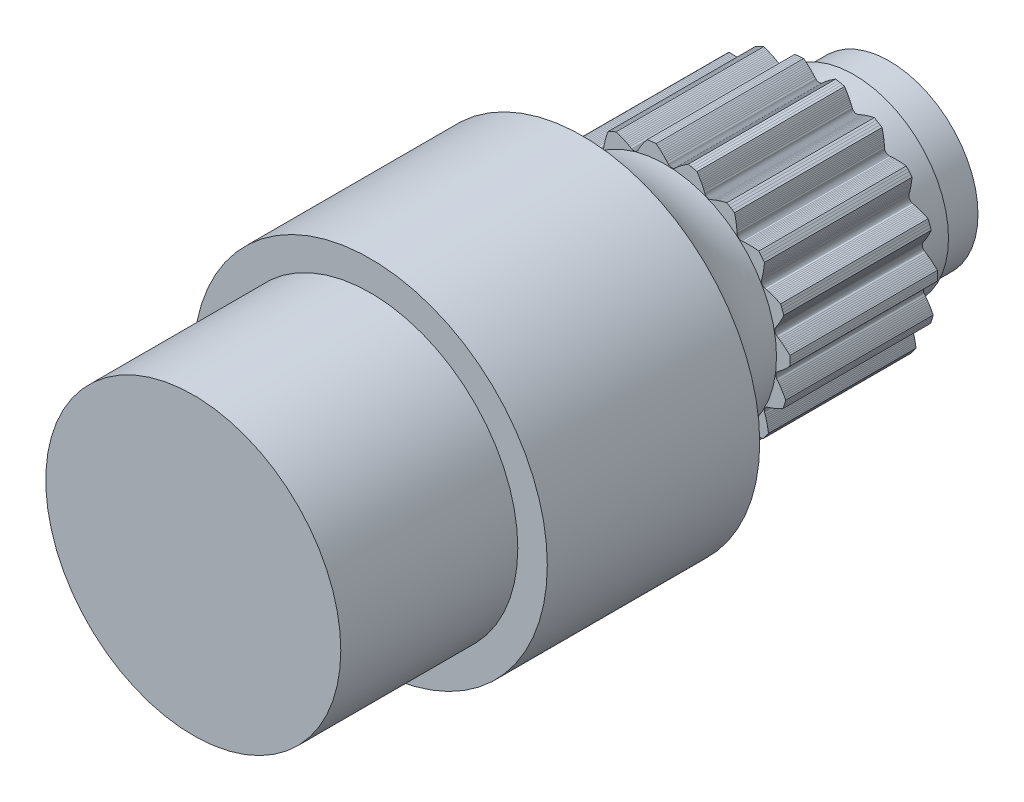
from build123d import *

# Parameters (mm, degrees)
BOSS_EXTRUDE1_DEPTH      = 6
BOSS_EXTRUDE1_DEPTH_BACK = 6.5


with BuildPart() as part:
    # 19T Shaft → Boss-Extrude1 (new, two sides: drawn at the far end of the back side and taken through both)
    with BuildSketch(Plane.XY.offset(-BOSS_EXTRUDE1_DEPTH_BACK)):
        Polygon((6.023106356, -8.692720522), (5.86435407, -8.800599502), (5.703670084, -8.90557959), (5.574457194, -8.88263519), (5.447639445, -8.857900166), (5.323239894, -8.831448754), (5.198405862, -8.802667164), (5.076149615, -8.772244747), (4.956489957, -8.740261879), (4.836752896, -8.706003916), (4.719768004, -8.670282776), (4.602985258, -8.632326454), (4.489107653, -8.593022605), (4.327362162, -8.533132654), (4.290916776, -8.521301114), (4.254021844, -8.513594141), (4.215833329, -8.509876971), (4.177758776, -8.510371404), (4.140158745, -8.515007457), (4.103409314, -8.523695892), (4.067890602, -8.536320589), (4.053138471, -8.54290106), (4.042867825, -8.547766359), (4.032591339, -8.552619311), (4.022309028, -8.557459908), (4.012020905, -8.562288143), (3.997558248, -8.569482551), (3.965220019, -8.588852651), (3.935135554, -8.611676643), (3.907636288, -8.637735147), (3.883030341, -8.666794799), (3.861601106, -8.698621956), (3.844073002, -8.731989591), (3.830012988, -8.767634612), (3.773308927, -8.930524327), (3.731178233, -9.04338666), (3.686159572, -9.157632939), (3.63928787, -9.270613062), (3.589536303, -9.384785534), (3.538078764, -9.497450788), (3.483765299, -9.611126472), (3.426545863, -9.725746938), (3.367805145, -9.838549658), (3.306201696, -9.952125968), (3.241692914, -10.066410845), (3.058468233, -10.123584954), (2.874236101, -10.177424384), (2.689057204, -10.2279114), (2.50299254, -10.275029372), (2.388230796, -10.211372806), (2.276315831, -10.146800338), (2.167245351, -10.081389669), (2.058520538, -10.013634001), (1.952766614, -9.945163416), (1.849975267, -9.87606004), (1.747849432, -9.804779708), (1.64880174, -9.733009106), (1.550671003, -9.659190066), (1.455725539, -9.585039811), (1.3221901, -9.475876187), (1.291561121, -9.452851915), (1.259167708, -9.433582762), (1.224255315, -9.417667208), (1.188083204, -9.405772064), (1.151015123, -9.397948213), (1.113435747, -9.394233364), (1.075742305, -9.394641113), (1.05965281, -9.396075027), (1.048358895, -9.397341838), (1.037063467, -9.398595073), (1.02576654, -9.399834732), (1.014468131, -9.401060812), (0.99845308, -9.403169391), (0.961577565, -9.410989759), (0.925712221, -9.422808675), (0.891241758, -9.43852626), (0.858533375, -9.458021842), (0.827930974, -9.481166455), (0.800518138, -9.507034773), (0.775646016, -9.536183169), (0.669124132, -9.671835292), (0.592629856, -9.764902619), (0.512954724, -9.858341183), (0.431938074, -9.949980515), (0.347810443, -10.0418125), (0.262558668, -10.131665005), (0.174277622, -10.221545872), (0.082941288, -10.311376766), (-0.009243679, -10.398994443), (-0.104387451, -10.486414267), (-0.202509208, -10.573560908), (-0.394370673, -10.568144209), (-0.586102234, -10.559246395), (-0.777640735, -10.546870395), (-0.968923083, -10.531020288), (-1.056797466, -10.433549734), (-1.141681923, -10.33613725), (-1.223603855, -10.238855584), (-1.304437427, -10.139468216), (-1.382228949, -10.040369314), (-1.457012949, -9.941633853), (-1.530460638, -9.841055481), (-1.600837777, -9.741012876), (-1.669682517, -9.639330557), (-1.735407025, -9.538369225), (-1.826261774, -9.391761502), (-1.847755223, -9.360039535), (-1.872136787, -9.331296313), (-1.899989758, -9.304907073), (-1.930339618, -9.281911376), (-1.962858848, -9.262475456), (-1.99719586, -9.246759884), (-2.032979363, -9.234906499), (-2.048662676, -9.23103847), (-2.059755988, -9.228569513), (-2.070846324, -9.226087225), (-2.081933669, -9.22359161), (-2.093018006, -9.22108267), (-2.108849972, -9.217876922), (-2.14626674, -9.2133001), (-2.184026396, -9.212833176), (-2.221732645, -9.216506598), (-2.258999003, -9.224325462), (-2.295458325, -9.236279452), (-2.329785287, -9.25184522), (-2.362774238, -9.271338311), (-2.507570644, -9.365052828), (-2.610139161, -9.42823986), (-2.715836727, -9.490745192), (-2.822218914, -9.551113189), (-2.931606074, -9.610653267), (-3.041413734, -9.667956109), (-3.154095739, -9.724302174), (-3.269651262, -9.779608923), (-3.385290807, -9.832546823), (-3.503664597, -9.884336868), (-3.624766315, -9.93490158), (-3.804473398, -9.867481057), (-3.982927298, -9.796810215), (-4.160069234, -9.722912332), (-4.335840855, -9.645811751), (-4.387305324, -9.525089654), (-4.435960726, -9.405393309), (-4.481856596, -9.286782624), (-4.526039357, -9.16653372), (-4.567438559, -9.047545404), (-4.606111203, -8.929877377), (-4.64292155, -8.810900194), (-4.677001681, -8.693426753), (-4.709100028, -8.574900013), (-4.73848131, -8.458068331), (-4.776809849, -8.28990373), (-4.786838617, -8.252921635), (-4.800566212, -8.21781912), (-4.81834146, -8.183815876), (-4.83958019, -8.152211566), (-4.864026605, -8.123269761), (-4.891400306, -8.097256493), (-4.921396172, -8.074426472), (-4.934973773, -8.06567566), (-4.944664349, -8.059738486), (-4.954347783, -8.053789669), (-4.96402406, -8.047829218), (-4.973693166, -8.041857141), (-4.987626407, -8.033684458), (-5.02152974, -8.017206417), (-5.057091864, -8.004504252), (-5.093947842, -7.995735439), (-5.131733787, -7.991030288), (-5.170099097, -7.990498255), (-5.207620326, -7.994074681), (-5.245151241, -8.001800087), (-5.412531233, -8.043421577), (-5.5300591, -8.069881018), (-5.650325129, -8.094679696), (-5.770544691, -8.117234549), (-5.893337586, -8.138030628), (-6.015801766, -8.156574154), (-6.140673887, -8.173279448), (-6.267926365, -8.188068707), (-6.394489147, -8.200590186), (-6.52326532, -8.211138197), (-6.654223748, -8.219641511), (-6.802302397, -8.097523223), (-6.948140388, -7.972737635), (-7.091689682, -7.845325851), (-7.232902994, -7.71532984), (-7.242380575, -7.584438313), (-7.249534353, -7.455429064), (-7.254430632, -7.328342668), (-7.257174694, -7.200263062), (-7.25769533, -7.074279562), (-7.256065838, -6.950430127), (-7.25224987, -6.825947156), (-7.246339882, -6.703772949), (-7.238213482, -6.581245998), (-7.22806762, -6.461204493), (-7.209716456, -6.289706257), (-7.207193771, -6.251471619), (-7.208779799, -6.213813712), (-7.2145511, -6.175881244), (-7.224377154, -6.139093138), (-7.238101607, -6.103781743), (-7.25554563, -6.070289718), (-7.276503343, -6.03895705), (-7.286503887, -6.02627174), (-7.293741604, -6.017509734), (-7.300968785, -6.008739034), (-7.308185419, -5.999959655), (-7.315391496, -5.991171609), (-7.32591613, -5.978917628), (-7.352632076, -5.952324018), (-7.382142959, -5.928763089), (-7.41415475, -5.908502277), (-7.448365589, -5.891782988), (-7.484479409, -5.878822587), (-7.521128898, -5.870022109), (-7.55913472, -5.865142663), (-7.730960078, -5.850160792), (-7.850711327, -5.837025351), (-7.972513129, -5.821430052), (-8.093542412, -5.803727593), (-8.216434525, -5.783526095), (-8.338284331, -5.761300828), (-8.461814736, -5.736555071), (-8.586974388, -5.709224196), (-8.710745368, -5.679972359), (-8.835969026, -5.648135294), (-8.962592786, -5.613655743), (-9.062996383, -5.450073102), (-9.160414655, -5.284695223), (-9.254815513, -5.117576581), (-9.346167863, -4.948772225), (-9.312631514, -4.821895397), (-9.277508445, -4.697553396), (-9.240874545, -4.575763073), (-9.201882546, -4.453732178), (-9.161468197, -4.334405761), (-9.119713149, -4.217795925), (-9.075684387, -4.101296827), (-9.030424718, -3.987661327), (-8.982954192, -3.874411862), (-8.934380648, -3.764168892), (-8.861338415, -3.607921517), (-8.84653765, -3.572577651), (-8.83581024, -3.536445171), (-8.828952184, -3.49869405), (-8.826300756, -3.460708711), (-8.827815989, -3.422854262), (-8.833440005, -3.385512863), (-8.843088469, -3.349072926), (-8.848428244, -3.333827771), (-8.852428782, -3.323190431), (-8.856416533, -3.31254829), (-8.86039149, -3.301901365), (-8.864353648, -3.291249669), (-8.870329167, -3.2762423), (-8.886962638, -3.242414952), (-8.90722432, -3.210548451), (-8.930922949, -3.180991214), (-8.957851405, -3.154069581), (-8.987800244, -3.130085273), (-9.019606452, -3.109861559), (-9.05396866, -3.092906025), (-9.21161944, -3.02294431), (-9.320617166, -2.971637417), (-9.430755625, -2.917338134), (-9.539479229, -2.861296698), (-9.649153292, -2.80228677), (-9.757184407, -2.741701162), (-9.86598666, -2.678185941), (-9.975490496, -2.611696655), (-10.083057167, -2.543841392), (-10.191158384, -2.473069292), (-10.299725828, -2.39934327), (-10.341574084, -2.212022994), (-10.380015856, -2.023974083), (-10.415038481, -1.835258482), (-10.446630423, -1.645938351), (-10.373714327, -1.536825295), (-10.300120542, -1.430624928), (-10.225926314, -1.327328549), (-10.149423643, -1.224570305), (-10.07245383, -1.124831841), (-9.995098034, -1.028098089), (-9.915627676, -0.93220735), (-9.835922914, -0.839424724), (-9.754252432, -0.747725082), (-9.672514902, -0.659227184), (-9.552696859, -0.535162498), (-9.527221905, -0.506539461), (-9.505343539, -0.475847922), (-9.486599303, -0.442369069), (-9.471757717, -0.407302797), (-9.460899531, -0.371007411), (-9.454094089, -0.333863157), (-9.451387746, -0.296264785), (-9.451488102, -0.280111832), (-9.451817942, -0.26875188), (-9.452134128, -0.25739154), (-9.45243666, -0.246030827), (-9.452725538, -0.23466976), (-9.453504402, -0.218535283), (-9.458252904, -0.181139915), (-9.467069715, -0.144421071), (-9.479887068, -0.108770395), (-9.496615027, -0.074563795), (-9.517153462, -0.04215465), (-9.540669693, -0.012699254), (-9.567664609, 0.014494973), (-9.694056904, 0.131855094), (-9.780489511, 0.215773542), (-9.867029415, 0.302892639), (-9.951665451, 0.391200092), (-10.036236578, 0.482623809), (-10.118742155, 0.575004368), (-10.201025843, 0.670406192), (-10.283007423, 0.768848743), (-10.362713267, 0.867954262), (-10.441977599, 0.969992141), (-10.520723759, 1.074975276), (-10.499481766, 1.265734129), (-10.474781276, 1.456076054), (-10.446630423, 1.645938351), (-10.415038481, 1.835258482), (-10.310644228, 1.914783675), (-10.206554755, 1.991333949), (-10.102840296, 2.06494262), (-9.997117203, 2.137292761), (-9.8919328, 2.206635063), (-9.787358957, 2.273010127), (-9.68105885, 2.337901259), (-9.575546242, 2.399776572), (-9.468526067, 2.459989312), (-9.362482082, 2.517152017), (-9.208872373, 2.595589682), (-9.175483838, 2.61439014), (-9.144825375, 2.636314833), (-9.116226187, 2.661893466), (-9.09080276, 2.690240695), (-9.068747808, 2.72104385), (-9.050250384, 2.753965803), (-9.035482506, 2.788648242), (-9.03033257, 2.803958569), (-9.026955968, 2.814810107), (-9.023566326, 2.825657578), (-9.020163649, 2.836500968), (-9.016747941, 2.84734026), (-9.012245748, 2.862853423), (-9.004594707, 2.899764443), (-9.00101121, 2.937356572), (-9.001558328, 2.975237384), (-9.006273055, 3.013022135), (-9.015175429, 3.050344082), (-9.027853334, 3.085839212), (-9.04455564, 3.120325216), (-9.125992882, 3.272365952), (-9.180494057, 3.379802089), (-9.234057466, 3.490300294), (-9.285434305, 3.601304281), (-9.335737903, 3.71523461), (-9.383777181, 3.829399252), (-9.430625591, 3.946349412), (-9.476200939, 4.06607745), (-9.519408591, 4.185693603), (-9.561246517, 4.307939875), (-9.601638025, 4.43280357), (-9.519607684, 4.606329319), (-9.434441612, 4.778337757), (-9.346167863, 4.948772225), (-9.254815513, 5.117576581), (-9.130255842, 5.158896122), (-9.006950389, 5.197500894), (-8.884954769, 5.233445214), (-8.761467993, 5.267546993), (-8.639467362, 5.298978818), (-8.51900767, 5.327802427), (-8.39739708, 5.35466199), (-8.277510556, 5.37892484), (-8.156737984, 5.401125694), (-8.037879054, 5.420758741), (-7.867123675, 5.445069445), (-7.829439724, 5.452010003), (-7.793323485, 5.462791969), (-7.757968512, 5.47769854), (-7.724718266, 5.496254865), (-7.693856543, 5.518227788), (-7.665671621, 5.543359835), (-7.640442538, 5.571367962), (-7.630600384, 5.584176552), (-7.623883247, 5.593343743), (-7.617155097, 5.602502853), (-7.610415943, 5.61165387), (-7.603665796, 5.620796781), (-7.594370428, 5.634007538), (-7.575148953, 5.666434328), (-7.559553475, 5.700826053), (-7.54777107, 5.736832027), (-7.53996165, 5.774100366), (-7.536263253, 5.812290703), (-7.536728985, 5.849979117), (-7.541328727, 5.888019804), (-7.568985928, 6.058265184), (-7.585649622, 6.177576637), (-7.60043211, 6.299479755), (-7.612982274, 6.421151272), (-7.623567167, 6.545242092), (-7.631934346, 6.668819308), (-7.638270724, 6.794644439), (-7.642501044, 6.922683573), (-7.644528285, 7.049848095), (-7.644406017, 7.179055479), (-7.642065826, 7.310268816), (-7.508136396, 7.447757253), (-7.371733809, 7.582792421), (-7.232902994, 7.71532984), (-7.091689682, 7.845325851), (-6.960462564, 7.843962125), (-6.831303192, 7.84043797), (-6.704246529, 7.834822815), (-6.576377777, 7.826980774), (-6.450781581, 7.817095997), (-6.327489717, 7.805244665), (-6.203747038, 7.791162008), (-6.082478161, 7.775183139), (-5.961040775, 7.7569663), (-5.842247111, 7.736942142), (-5.672850056, 7.704491445), (-5.63495433, 7.698819985), (-5.59729407, 7.697290831), (-5.559014571, 7.699909982), (-5.521540686, 7.706664537), (-5.48521654, 7.717426122), (-5.450398392, 7.732044815), (-5.417442066, 7.750343515), (-5.403974245, 7.759262358), (-5.394644479, 7.765751794), (-5.385306921, 7.772230012), (-5.375961582, 7.778697002), (-5.366608478, 7.785152756), (-5.353527234, 7.794629517), (-5.32481827, 7.819058131), (-5.298900823, 7.846522574), (-5.2760657, 7.876751904), (-5.256578407, 7.909465227), (-5.240680017, 7.944385439), (-5.228883106, 7.980183013), (-5.22088183, 8.017656085), (-5.191761904, 8.187657379), (-5.168782347, 8.305914901), (-5.143182001, 8.426012838), (-5.115545485, 8.545166888), (-5.085264636, 8.665971035), (-5.053053003, 8.785569314), (-5.018190705, 8.906634312), (-4.980617576, 9.029109514), (-4.941244722, 9.150042156), (-4.89917551, 9.272209027), (-4.854357216, 9.395553005), (-4.68304203, 9.482105125), (-4.510184263, 9.565533867), (-4.335840855, 9.645811751), (-4.160069234, 9.722912332), (-4.036395164, 9.679013121), (-3.915378295, 9.633741935), (-3.797029151, 9.587175793), (-3.678634987, 9.53823974), (-3.563053521, 9.488109529), (-3.450290071, 9.436867532), (-3.337824743, 9.383368731), (-3.228314879, 9.328879701), (-3.119372303, 9.272219245), (-3.013517041, 9.214707812), (-2.863835109, 9.129012249), (-2.829834198, 9.111343363), (-2.794710991, 9.097668796), (-2.757655144, 9.0877167), (-2.720018497, 9.081937525), (-2.682168213, 9.080321586), (-2.644489926, 9.082842765), (-2.607377687, 9.089449089), (-2.591743646, 9.09351169), (-2.580812276, 9.096620141), (-2.569877178, 9.09971545), (-2.558938368, 9.102797615), (-2.547995861, 9.10586663), (-2.532546295, 9.110582441), (-2.497460903, 9.12436566), (-2.464030046, 9.141926622), (-2.432616745, 9.163103491), (-2.403563329, 9.187716803), (-2.377187783, 9.215582742), (-2.354406608, 9.245610255), (-2.334671377, 9.278454922), (-2.251929918, 9.429789852), (-2.191797303, 9.534178406), (-2.128588318, 9.639456686), (-2.063759968, 9.743181079), (-1.995894777, 9.847607549), (-1.92659496, 9.950266563), (-1.854311857, 10.053452156), (-1.779006911, 10.157091339), (-1.702500622, 10.258687172), (-1.623043318, 10.360574854), (-1.540603679, 10.462683239), (-1.350467395, 10.488919776), (-1.15988627, 10.511701294), (-0.968923083, 10.531020288), (-0.777640735, 10.546870395), (-0.674921718, 10.46519286), (-0.575161406, 10.383080478), (-0.478344747, 10.300609514), (-0.382255016, 10.21588243), (-0.289213325, 10.13093917), (-0.199197959, 10.045859374), (-0.110197346, 9.958741853), (-0.024313587, 9.871647395), (0.06032856, 9.782683362), (0.14177436, 9.693916909), (0.255520808, 9.564262925), (0.281942378, 9.53651131), (0.310722388, 9.512173182), (0.342539007, 9.490728305), (0.376259902, 9.473041661), (0.411534659, 9.459223312), (0.447990057, 9.449373766), (0.485236523, 9.443571817), (0.501342593, 9.44233793), (0.512690983, 9.441728546), (0.524038633, 9.441105523), (0.535385525, 9.440468862), (0.546731644, 9.439818563), (0.562875331, 9.439262392), (0.600535104, 9.44090659), (0.63785662, 9.44666107), (0.67444398, 9.456490636), (0.709915131, 9.470336701), (0.743909633, 9.488128661), (0.775206379, 9.509132165), (0.804536947, 9.533789198), (0.931933616, 9.650058277), (1.022702988, 9.729265743), (1.116670938, 9.808315832), (1.211665964, 9.88537042), (1.309761252, 9.962102984), (1.40863954, 10.036698036), (1.510510452, 10.110822463), (1.615386757, 10.184394714), (1.720735837, 10.255644253), (1.828970802, 10.326211635), (1.940098172, 10.396019398), (2.128451338, 10.359097217), (2.316103398, 10.31876278), (2.50299254, 10.275029372), (2.689057204, 10.2279114), (2.759689969, 10.117306568), (2.827383145, 10.007251142), (2.892175733, 9.897812364), (2.955548218, 9.786475742), (3.015967622, 9.675924355), (3.073480342, 9.566226476), (3.129371644, 9.45493077), (3.182322459, 9.344668919), (3.233491887, 9.233041943), (3.281702309, 9.122639693), (3.347187081, 8.963077308), (3.363166122, 8.928250282), (3.382484175, 8.895886007), (3.405613742, 8.865272233), (3.431764701, 8.837594744), (3.460641364, 8.813071416), (3.491923366, 8.791918497), (3.525267826, 8.774337006), (3.540100582, 8.767940343), (3.550636219, 8.763679161), (3.561166726, 8.759405319), (3.571692089, 8.755118823), (3.582212292, 8.75081968), (3.597300682, 8.745051798), (3.633453814, 8.734378801), (3.670621624, 8.72770321), (3.708418235, 8.725120287), (3.746463271, 8.72669867), (3.784392897, 8.732488617), (3.820813726, 8.742192056), (3.856561208, 8.755989483), (4.014807682, 8.824593151), (4.126377542, 8.870036171), (4.240921571, 8.914291765), (4.355789088, 8.956326488), (4.473484325, 8.997049982), (4.59122609, 9.035497541), (4.711645517, 9.072528271), (4.834728205, 9.108060894), (4.957503868, 9.141243146), (5.082787556, 9.172843157), (5.210560282, 9.202785546), (5.376719341, 9.106705737), (5.541107325, 9.007626206), (5.703670084, 8.90557959), (5.86435407, 8.800599502), (5.895246427, 8.673053124), (5.923536862, 8.546980865), (5.949284095, 8.422433664), (5.973071942, 8.296552554), (5.994321679, 8.172372999), (6.013099358, 8.049944503), (6.029824659, 7.926531229), (6.044104489, 7.805050568), (6.056256195, 7.682857163), (6.066006892, 7.562782913), (6.076133696, 7.390603188), (6.079938632, 7.3524748), (6.087701317, 7.315591549), (6.099637384, 7.279126356), (6.115384546, 7.244457307), (6.13473388, 7.211886484), (6.157452596, 7.181722439), (6.18328166, 7.154266633), (6.195233743, 7.14340037), (6.203814926, 7.135949155), (6.212387148, 7.128487632), (6.220950395, 7.121015811), (6.229504655, 7.113533703), (6.241902685, 7.103179148), (6.272631425, 7.081345541), (6.30561782, 7.062963284), (6.340527832, 7.048247771), (6.377023983, 7.03738743), (6.41477847, 7.030547932), (6.452376619, 7.027899788), (6.490667222, 7.029342444), (6.66261504, 7.04284643), (6.782895061, 7.049600548), (6.905602547, 7.054265866), (7.027894878, 7.05672561), (7.152435959, 7.057027012), (7.276282052, 7.055160687), (7.402200681, 7.051084867), (7.530151833, 7.04472735), (7.657049432, 7.036246504), (7.78580541, 7.025454792), (7.916377336, 7.012287083), (8.042336376, 6.867461385), (8.165646294, 6.720373565), (8.286266472, 6.571072075), (8.404157178, 6.419606092), (8.391961461, 6.288939797), (8.377783446, 6.160512592), (8.361695213, 6.034353588), (8.343320639, 5.907569164), (8.323097971, 5.78321822), (8.301105757, 5.661326136), (8.27685261, 5.539169037), (8.250914012, 5.41963388), (8.222731173, 5.300115599), (8.192965505, 5.183381257), (8.146636945, 5.017242536), (8.137855452, 4.979944588), (8.133221561, 4.942539234), (8.13267067, 4.904174191), (8.136307586, 4.866270512), (8.14403279, 4.829181747), (8.155726294, 4.793275318), (8.171240983, 4.75892046), (8.179017199, 4.744762127), (8.184714025, 4.734928333), (8.190399027, 4.7250877), (8.196072197, 4.715240241), (8.201733527, 4.705385971), (8.21009768, 4.69156682), (8.232072091, 4.660938613), (8.257302483, 4.632841692), (8.285542855, 4.607588244), (8.316535197, 4.585466065), (8.35002326, 4.566738288), (8.384724387, 4.552025529), (8.421408729, 4.54095708), (8.588424678, 4.497898017), (8.704380654, 4.465231319), (8.821954335, 4.429800802), (8.938419208, 4.392419016), (9.056310175, 4.352265663), (9.17283995, 4.310287701), (9.290612544, 4.265547008), (9.409566667, 4.217988288), (9.526834878, 4.168763374), (9.64511044, 4.116749389), (9.764332069, 4.061898508), (9.836441474, 3.884021032), (9.905310784, 3.704864172), (9.970917313, 3.52448694), (10.033239452, 3.342948752), (9.979277255, 3.22332226), (9.924167199, 3.106457189), (9.867986909, 2.992357669), (9.809441085, 2.878408988), (9.749937452, 2.767362012), (9.689558541, 2.659215237), (9.626955152, 2.551551931), (9.563608977, 2.446915767), (9.498145639, 2.343024269), (9.432089178, 2.242279812), (9.334325673, 2.100185804), (9.313909361, 2.067760109), (9.297381049, 2.033886102), (9.284402897, 1.997778657), (9.275535451, 1.960747798), (9.27079938, 1.923160235), (9.270200499, 1.885402442), (9.273719555, 1.847871413), (9.276477231, 1.831955284), (9.278672359, 1.820804556), (9.280854084, 1.809651199), (9.283022401, 1.798495227), (9.285177309, 1.787336657), (9.288601198, 1.771550431), (9.299440012, 1.735446664), (9.314180296, 1.700679817), (9.332690746, 1.667625037), (9.354820778, 1.636638302), (9.380413466, 1.608051691), (9.408457165, 1.582868672), (9.439559929, 1.560488556), (9.583545238, 1.465532562), (9.68261154, 1.396984992), (9.782310485, 1.325298086), (9.880327124, 1.252125665), (9.978792661, 1.175868798), (10.075378309, 1.098328162), (10.172242379, 1.017770944), (10.269308949, 0.934164746), (10.364239941, 0.849530047), (10.459218093, 0.761930312), (10.554169914, 0.671340203), (10.564615511, 0.479686734), (10.571581154, 0.287875258), (10.575064549, 0.095968957), (10.575064549, -0.095968957), (10.485183515, -0.191592259), (10.395113447, -0.284231052), (10.304929106, -0.373906635), (10.212556381, -0.462671464), (10.120219924, -0.548380811), (10.027997308, -0.631062895), (9.933827725, -0.712565418), (9.839938514, -0.790963637), (9.744288646, -0.867970096), (9.649099635, -0.941807442), (9.510495377, -1.044458647), (9.480656671, -1.068498263), (9.454025036, -1.095170149), (9.430026009, -1.125107194), (9.409615125, -1.157252363), (9.392931006, -1.191265529), (9.380104638, -1.226783045), (9.371246717, -1.263423174), (9.368687016, -1.27937234), (9.367142571, -1.290631647), (9.365584594, -1.30188909), (9.364013088, -1.313144652), (9.362428055, -1.324398317), (9.360540649, -1.340440937), (9.359069312, -1.378107859), (9.361722151, -1.415777105), (9.368496783, -1.453051219), (9.379366373, -1.489544617), (9.394290321, -1.524892259), (9.412637622, -1.557816566), (9.43478834, -1.589083117), (9.540139968, -1.725646086), (9.611581224, -1.822646336), (9.682601505, -1.922821242), (9.751548286, -2.02385493), (9.819918124, -2.127951697), (9.886093092, -2.232652277), (9.951551914, -2.340296395), (10.016212261, -2.450890042), (10.078518789, -2.561763041), (10.139907175, -2.675455737), (10.200299684, -2.79196823), (10.14794953, -2.976629065), (10.092256671, -3.160309407), (10.033239452, -3.342948752), (9.970917313, -3.52448694), (9.854857446, -3.585744783), (9.739587856, -3.644118448), (9.625172338, -3.699652353), (9.508982728, -3.753614284), (9.393819536, -3.804698063), (9.279746967, -3.852955569), (9.164215926, -3.899465248), (9.049958031, -3.943129858), (8.93448678, -3.984906433), (8.820480425, -4.023835247), (8.656055336, -4.075919797), (8.620027724, -4.088968269), (8.586178717, -4.10554772), (8.55375948, -4.126070223), (8.524016994, -4.149846274), (8.49719281, -4.176599188), (8.473528892, -4.206027552), (8.453253887, -4.237806256), (8.445654192, -4.252060119), (8.440537538, -4.262207885), (8.435408691, -4.272349494), (8.430267659, -4.282484932), (8.425114448, -4.292614183), (8.418120277, -4.30717473), (8.404498231, -4.342323012), (8.394776148, -4.378812609), (8.389080827, -4.416266829), (8.387512085, -4.454312264), (8.390150052, -4.492590471), (8.396812741, -4.529688207), (8.407611039, -4.566452977), (8.462912501, -4.729824205), (8.498986944, -4.844765652), (8.533632411, -4.962573053), (8.566037881, -5.08051944), (8.596903088, -5.201175607), (8.625496291, -5.321690198), (8.652456385, -5.444756305), (8.677703558, -5.570352864), (8.700633742, -5.695449355), (8.721779978, -5.822914643), (8.74106871, -5.952723584), (8.631595756, -6.110380918), (8.51927958, -6.26602551), (8.404157178, -6.419606092), (8.286266472, -6.571072075), (8.156604659, -6.591326222), (8.028626795, -6.609109066), (7.902378796, -6.624483333), (7.77496325, -6.637794752), (7.649453041, -6.648717245), (7.525892052, -6.657320724), (7.401519133, -6.663797512), (7.27927417, -6.667996775), (7.156494638, -6.670016326), (7.036025297, -6.669818066), (6.863597387, -6.665691793), (6.825285018, -6.666335116), (6.787886705, -6.671025492), (6.750560386, -6.67990952), (6.714709359, -6.69273995), (6.680651926, -6.709333519), (6.648714811, -6.729483712), (6.619219833, -6.752957274), (6.607403689, -6.763971206), (6.599269295, -6.771907764), (6.591125368, -6.779834539), (6.58297192, -6.78775152), (6.574808962, -6.795658695), (6.563465952, -6.807159308), (6.539169358, -6.835980088), (6.518125891, -6.867335823), (6.500577793, -6.900911402), (6.486740717, -6.936386061), (6.476806838, -6.973446796), (6.471062909, -7.010697846), (6.469338625, -7.0489768), (6.46859715, -7.221452481), (6.465395553, -7.341879435), (6.459911833, -7.464553071), (6.452264355, -7.586630836), (6.442280207, -7.710771436), (6.430193128, -7.834040411), (6.41573295, -7.959192385), (6.398831025, -8.08618152), (6.379900024, -8.211945357), (6.358512587, -8.339370396), (6.334607308, -8.468408971), (6.179874649, -8.581978186), align=None)
    extrude(amount=BOSS_EXTRUDE1_DEPTH + BOSS_EXTRUDE1_DEPTH_BACK)

    # Sketch3 → Revolve2 (revolve)
    with BuildSketch(Plane(origin=(0, 0, 0), x_dir=(0, 0, -1), z_dir=(1, 0, 0))):
        with BuildLine():
            ThreePointArc((-6, 9.422433664), (-10.352994849, 11.140684707), (-13, 15))
            Line((-13, 15), (-31, 15))
            Line((-31, 15), (-31, 12.5))
            Line((-31, 12.5), (-46, 12.5))
            Line((-46, 12.5), (-46, 0))
            Line((-46, 0), (12.9958, 0))
            Line((12.9958, 0), (12.9958, 7.5))
            Line((12.9958, 7.5), (9.9958, 7.5))
            Line((9.9958, 7.5), (9.9958, 8))
            Line((9.9958, 8), (6.5, 8))
            Line((6.5, 8), (-6, 8.422433664))
            Line((-6, 8.422433664), (-6, 9.422433664))
        make_face()
    revolve(axis=Axis((0, 0, -6.5), (0, 0, -1)))


solid = part.part
